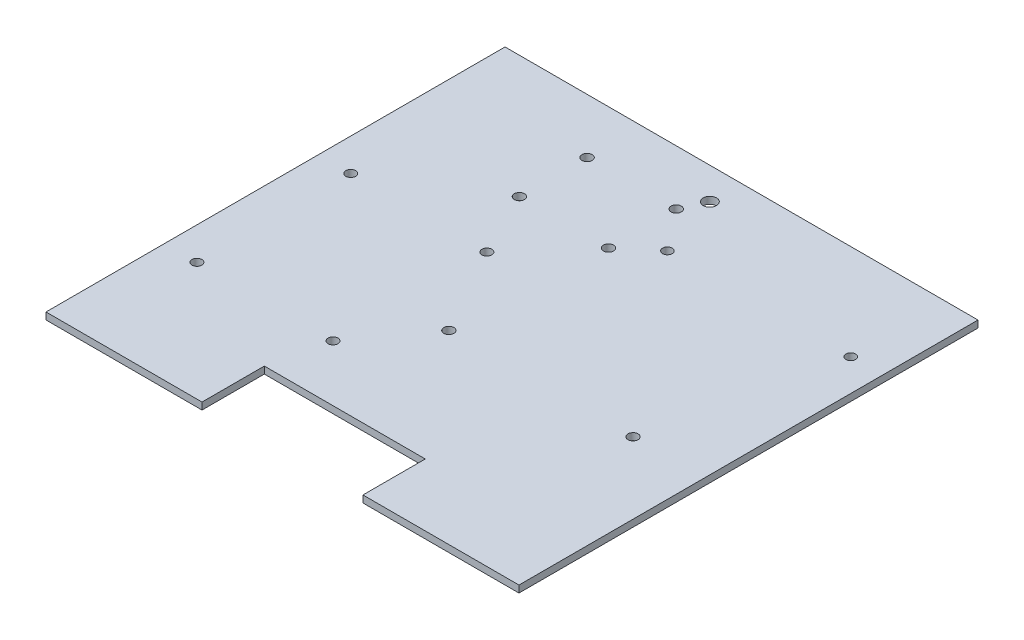
from build123d import *

# Parameters (mm, degrees)
SKETCH1_W           = 189.738
SKETCH1_H           = 184.15
BOSS_EXTRUDE1_DEPTH = 2.794
SKETCH2_R           = 2.6797
CUT_EXTRUDE1_DEPTH  = 133.233653893
CUT_EXTRUDE2_DEPTH  = 133.233653893
SKETCH4_R           = 1.936199963
SKETCH4_R_2         = 2.048699992
SKETCH4_R_3         = 1.9812
SKETCH4_R_4         = 2.038700012
CUT_EXTRUDE3_DEPTH  = 133.233653893


with BuildPart() as part:
    # Sketch1 → Boss-Extrude1 (new body)
    with BuildSketch(Plane(origin=(0, 0, 0), x_dir=(1, 0, 0), z_dir=(0, 1, 0))):
        Rectangle(SKETCH1_W, SKETCH1_H)
    extrude(amount=BOSS_EXTRUDE1_DEPTH)

    # Sketch2 → Cut-Extrude1 (cut, through all)
    with BuildSketch(Plane(origin=(0, 2.794, 0), x_dir=(1, 0, 0), z_dir=(0, 1, 0))):
        with Locations((0, 79.375)):
            Circle(SKETCH2_R)
    extrude(amount=-CUT_EXTRUDE1_DEPTH, mode=Mode.SUBTRACT)

    # Sketch3 → Cut-Extrude2 (cut, through all)
    with BuildSketch(Plane(origin=(0, 2.794, 0), x_dir=(1, 0, 0), z_dir=(0, 1, 0))):
        Polygon((0, -92.075), (-32.28, -92.075), (-32.28, -67.074999962), (32.28, -67.074999962), (32.28, -92.075), align=None)
    extrude(amount=-CUT_EXTRUDE2_DEPTH, mode=Mode.SUBTRACT)

    # Sketch4 → Cut-Extrude3 (cut, through all)
    with BuildSketch(Plane(origin=(0, 2.794, 0), x_dir=(1, 0, 0), z_dir=(0, 1, 0))):
        with Locations((8.5515, 53.787500062)):
            Circle(SKETCH4_R)
        with Locations((82.1065, 53.7875)):
            Circle(SKETCH4_R)
        with Locations((-39.976, 70.1)):
            Circle(SKETCH4_R_2)
        with Locations((-4.226, 70.1)):
            Circle(SKETCH4_R_2)
        with Locations((-4.226, 42.95)):
            Circle(SKETCH4_R_2)
        with Locations((-39.976, 42.95)):
            Circle(SKETCH4_R_2)
        with Locations((-81.8515, -44.557)):
            Circle(SKETCH4_R_3)
        with Locations((-81.8515, 17.165)):
            Circle(SKETCH4_R_3)
        with Locations((-27.2415, 17.165)):
            Circle(SKETCH4_R_3)
        with Locations((-27.2415, -44.557)):
            Circle(SKETCH4_R_3)
        with Locations((66.241, -17.689999962)):
            Circle(SKETCH4_R_4)
        with Locations((-7.639, -17.689999962)):
            Circle(SKETCH4_R_4)
    extrude(amount=-CUT_EXTRUDE3_DEPTH, mode=Mode.SUBTRACT)


solid = part.part
